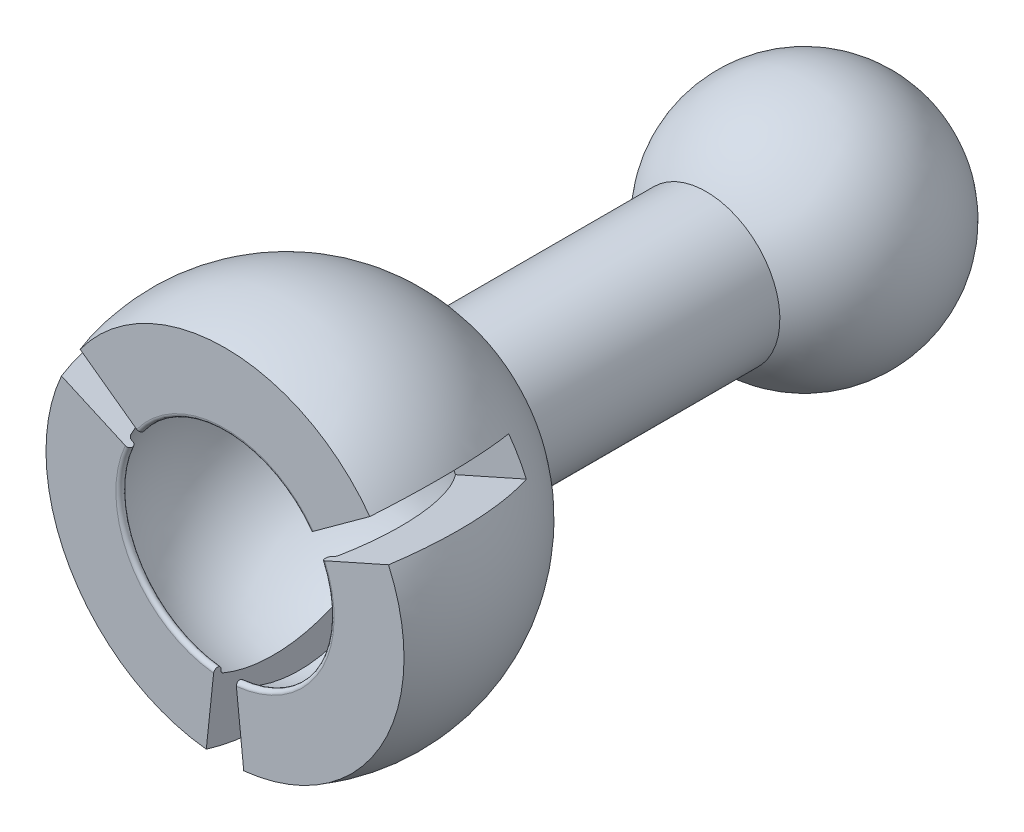
from build123d import *

# Parameters (mm, degrees)
CORTAR_REVOLUCI_N1_START = 13.6
CORTAR_REVOLUCI_N1_DEPTH = 6
MATRIZC1_COUNT           = 3
CROQUIS4_R               = 0.75
CORTAR_EXTRUIR1_DEPTH    = 31.606861976


# Read off the part's stored shape, not the designer's step: Cortar-Revolución1
with BuildPart() as part:
    # Croquis1 → Revolución1 (revolve)
    with BuildSketch(Plane.YZ):
        with BuildLine():
            Line((0, 0), (0, -9))
            ThreePointArc((0, -9), (-4.74341649, -5.58113883), (-3, 0))
            Line((-3, 0), (-3, 10))
            ThreePointArc((-3, 10), (-7.036805787, 13.954628111), (-7.291090453, 19.6))
            Line((-7.291090453, 19.6), (-4.445222154, 19.6))
            ThreePointArc((-4.445222154, 19.6), (-4.295338521, 19.444092675), (-4.45702764, 19.300465287))
            ThreePointArc((-4.45702764, 19.300465287), (-4.57485069, 19.273071665), (-4.655330258, 19.182762635))
            ThreePointArc((-4.655330258, 19.182762635), (-4.279724841, 14.326202011), (0, 12))
            Line((0, 12), (0, 0))
        make_face()
    revolve(axis=Axis((0, 0, 0), (0, 0, -1)))

    # Cortar-Revolución1 outline → Cortar-Revolución1 (cut)
    with BuildSketch(Plane.XY.offset(CORTAR_REVOLUCI_N1_START)):
        Polygon((0.945938118, -9), (0.805683263, -7.665564198), (0.387742836, -3.689126657), (0.21020847, -2), (-0.21020847, -2), (-0.387742836, -3.689126657), (-0.805683263, -7.665564198), (-0.945938118, -9), align=None)
    cortar_revoluci_n1 = extrude(amount=CORTAR_REVOLUCI_N1_DEPTH, mode=Mode.SUBTRACT)

    # MatrizC1: Cortar-Revolución1 ×3 about axis
    matrizc1_axis = Axis((0, 0, 0), (0, 0, 1))
    for i in range(1, MATRIZC1_COUNT):
        add(cortar_revoluci_n1.rotate(matrizc1_axis, i * 360 / MATRIZC1_COUNT), mode=Mode.SUBTRACT)

    # Croquis4 → Cortar-Extruir1 (cut, through all)
    with BuildSketch(Plane.XY.offset(19.6)):
        Circle(CROQUIS4_R)
    extrude(amount=-CORTAR_EXTRUIR1_DEPTH, mode=Mode.SUBTRACT)


solid = part.part
